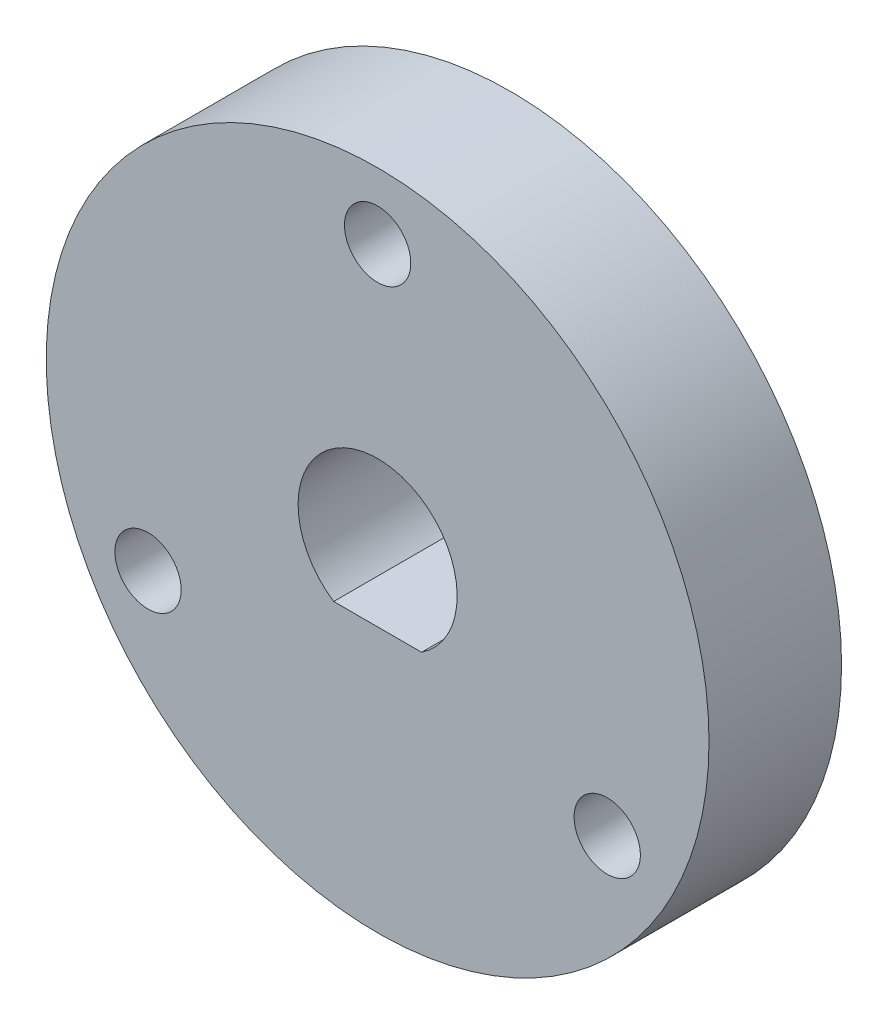
from build123d import *

# Parameters (mm, degrees)
SKETCH1_R           = 25
BOSS_EXTRUDE1_DEPTH = 10
SKETCH2_R           = 2.5
CUT_EXTRUDE1_DEPTH  = 37.742346142


with BuildPart() as part:
    # Sketch1 → Boss-Extrude1 (new body)
    with BuildSketch(Plane.XY):
        Circle(SKETCH1_R)
        with BuildLine():
            Line((-3.31662479, -5), (3.31662479, -5))
            ThreePointArc((3.31662479, -5), (0, 6), (-3.31662479, -5))
        make_face(mode=Mode.SUBTRACT)
    extrude(amount=-BOSS_EXTRUDE1_DEPTH)

    # Sketch2 → Cut-Extrude1 (cut, through all)
    with BuildSketch(Plane(origin=(0, 0, -10), x_dir=(-1, 0, 0), z_dir=(0, 0, -1))):
        with Locations((0, 20)):
            Circle(SKETCH2_R)
        with Locations((17.320508076, -10)):
            Circle(SKETCH2_R)
        with Locations((-17.320508076, -10)):
            Circle(SKETCH2_R)
    extrude(amount=-CUT_EXTRUDE1_DEPTH, mode=Mode.SUBTRACT)


solid = part.part
